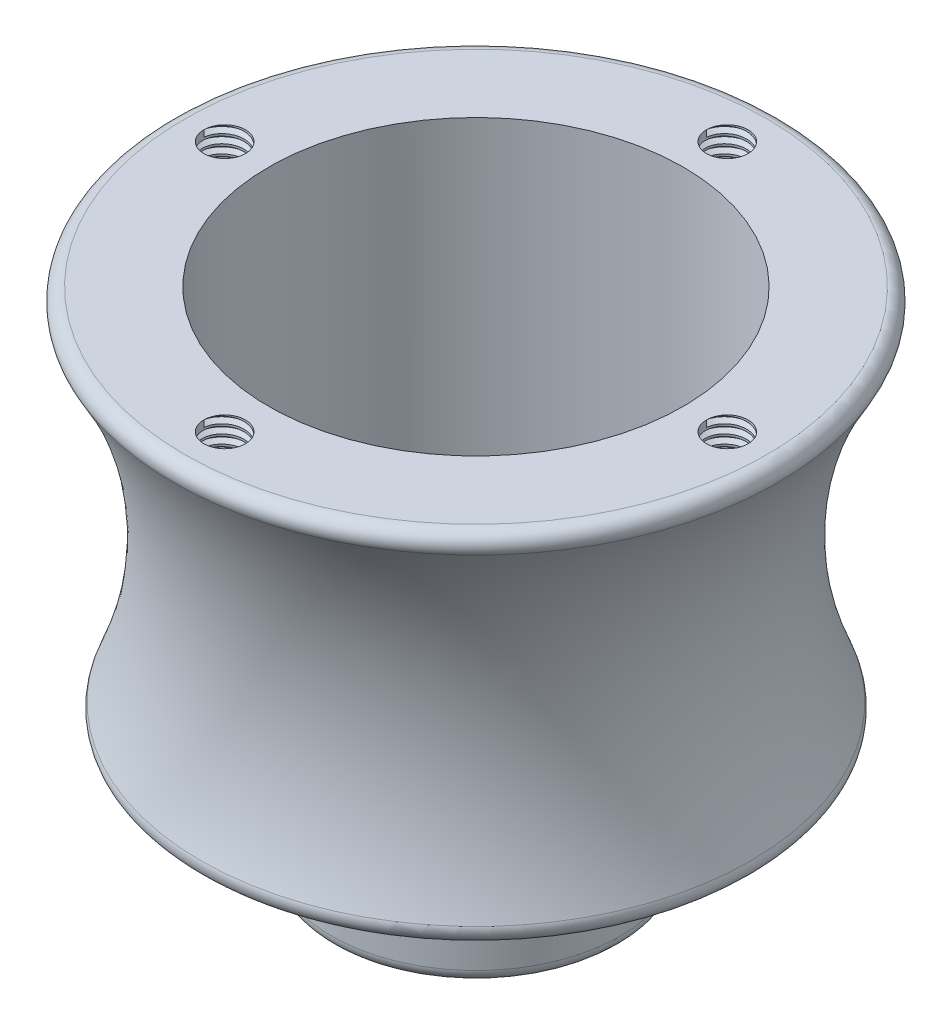
from build123d import *

# Parameters (mm, degrees)
REDONDEO4_R    = 1
REDONDEO3_R    = 1
REDONDEO5_R    = 1
MATRIZC1_COUNT = 4
ROSCA1_PITCH   = 0.7
ROSCA2_PITCH   = 0.7
ROSCA3_PITCH   = 0.7
ROSCA4_PITCH   = 0.7


with BuildPart() as part:
    # Croquis1 → Revolución1 (revolve)
    with BuildSketch(Plane.XY, mode=Mode.PRIVATE) as revoluci_n1_sk:
        with BuildLine():
            Line((25, 40), (16.5, 40))
            Line((16.5, 40), (16.5, 15))
            Line((16.5, 15), (6.35, 15))
            Line((6.35, 15), (6.35, 0))
            Line((6.35, 0), (11.5, 0))
            Line((11.5, 0), (11.5, 10))
            Line((11.5, 10), (22.5, 10))
            ThreePointArc((22.5, 10), (19.714661715, 25.33627819), (25, 40))
        make_face()
    revolve(revoluci_n1_sk.sketch.rotate(Axis((0, 0, 0), (0, 1, 0)), 90), axis=Axis((0, 0, 0), (0, 1, 0)))

    # Redondeo4
    redondeo4_edges = [part.edges().sort_by_distance(p)[0] for p in [
        (0, 10, 11.5),
    ]]
    fillet(redondeo4_edges, radius=REDONDEO4_R)

    # Redondeo3
    redondeo3_edges = [part.edges().sort_by_distance(p)[0] for p in [
        (0, 15, 16.5),
        (0, 0, 11.5),
        (0, 0, 6.35),
        (0, 15, 6.35),
    ]]
    fillet(redondeo3_edges, radius=REDONDEO3_R)

    # Redondeo5
    redondeo5_edges = [part.edges().sort_by_distance(p)[0] for p in [
        (0, 40, 25),
        (0, 10, 22.5),
    ]]
    fillet(redondeo5_edges, radius=REDONDEO5_R)

    # Croquis5 → Perforador para roscar Helicoil de M41 (revolve, cut)
    with BuildSketch(Plane(origin=(0, 40, -20), x_dir=(0, 0, 1), z_dir=(1, 0, 0))):
        Polygon((0, 0), (0, 5.991420021), (1.65, 5), (1.65, 0), align=None)
    perforador_para_roscar_helicoil_de_m41 = revolve(axis=Axis((0, 46.35, -20), (0, -1, 0)), mode=Mode.SUBTRACT)

    # MatrizC1: Perforador para roscar Helicoil de M41 ×4 about axis
    matrizc1_axis = Axis((0, 0, 0), (0, 1, 0))
    for i in range(1, MATRIZC1_COUNT):
        add(perforador_para_roscar_helicoil_de_m41.rotate(matrizc1_axis, i * 360 / MATRIZC1_COUNT), mode=Mode.SUBTRACT)

    # Rosca1: the profile of Perfil de rosca1 profile screwed along a right-hand helix of 7.142857 turns, 6 arcs to a turn; built about Z, then put on its axis
    rosca1_z = Axis((0, 0, 0), (0, 0, 1))
    rosca1_corners = [(1.6497, 0, -0.000173205), (2.028886112, 0, 0.218749999), (2.028886112, 0, 0.306249999), (1.6497, 0, 0.525173203)]
    with BuildLine(mode=Mode.PRIVATE) as rosca1_profile:
        Line(rosca1_corners[0], rosca1_corners[1])
        Line(rosca1_corners[1], rosca1_corners[2])
        Line(rosca1_corners[2], rosca1_corners[3])
        Line(rosca1_corners[3], rosca1_corners[0])
    rosca1_cap = Face(rosca1_profile.wire())
    rosca1_turn_angles = [0, 30, 60, 90, 120, 150, 180, 210, 240, 270, 300, 330, 360]
    rosca1_turn_weights = [1, 0.8660254037844387, 1, 0.8660254037844387, 1, 0.8660254037844387, 1, 0.8660254037844387, 1, 0.8660254037844387, 1, 0.8660254037844387, 1]
    rosca1_turn_rails = [Edge.make_bspline([Vector(p[0], p[1], 0).rotate(rosca1_z, rosca1_turn_angles[k]) / rosca1_turn_weights[k] + Vector(0, 0, p[2] + ROSCA1_PITCH * rosca1_turn_angles[k] / 360) for k in range(13)], [0, 0, 0, 1, 1, 2, 2, 3, 3, 4, 4, 5, 5, 6, 6, 6], 2, rosca1_turn_weights) for p in rosca1_corners]
    rosca1_turn_sides = [Face.make_surface_from_curves(rosca1_turn_rails[p[0]], rosca1_turn_rails[p[1]]) for p in [(0, 1), (1, 2), (2, 3), (3, 0)]]
    rosca1_last_angles = [2520, 2545.714285714, 2571.428571429]
    rosca1_last_weights = [1, 0.9009688679024186, 1]
    rosca1_last_rails = [Edge.make_bspline([Vector(p[0], p[1], 0).rotate(rosca1_z, rosca1_last_angles[k]) / rosca1_last_weights[k] + Vector(0, 0, p[2] + ROSCA1_PITCH * rosca1_last_angles[k] / 360) for k in range(3)], [0, 0, 0, 1, 1, 1], 2, rosca1_last_weights) for p in rosca1_corners]
    rosca1_last_sides = [Face.make_surface_from_curves(rosca1_last_rails[p[0]], rosca1_last_rails[p[1]]) for p in [(0, 1), (1, 2), (2, 3), (3, 0)]]
    rosca1 = Plane(origin=(0, 40, -20), x_dir=(-1, 0, 0), z_dir=(0, -1, 0)) * Solid(Shell([*[p.moved(Location((0, 0, ROSCA1_PITCH * i))) for i in range(7) for p in rosca1_turn_sides], *rosca1_last_sides, rosca1_cap, rosca1_cap.rotate(rosca1_z, 2571.428571429).moved(Location((0, 0, ROSCA1_PITCH * 2571.428571429 / 360)))]))
    add(rosca1, mode=Mode.SUBTRACT)

    # Rosca2: the profile of Perfil de rosca2 profile screwed along a right-hand helix of 7.142857 turns, 6 arcs to a turn; built about Z, then put on its axis
    rosca2_z = Axis((0, 0, 0), (0, 0, 1))
    rosca2_corners = [(1.6497, 0, -0.000173205), (2.028886112, 0, 0.218749999), (2.028886112, 0, 0.306249999), (1.6497, 0, 0.525173203)]
    with BuildLine(mode=Mode.PRIVATE) as rosca2_profile:
        Line(rosca2_corners[0], rosca2_corners[1])
        Line(rosca2_corners[1], rosca2_corners[2])
        Line(rosca2_corners[2], rosca2_corners[3])
        Line(rosca2_corners[3], rosca2_corners[0])
    rosca2_cap = Face(rosca2_profile.wire())
    rosca2_turn_angles = [0, 30, 60, 90, 120, 150, 180, 210, 240, 270, 300, 330, 360]
    rosca2_turn_weights = [1, 0.8660254037844387, 1, 0.8660254037844387, 1, 0.8660254037844387, 1, 0.8660254037844387, 1, 0.8660254037844387, 1, 0.8660254037844387, 1]
    rosca2_turn_rails = [Edge.make_bspline([Vector(p[0], p[1], 0).rotate(rosca2_z, rosca2_turn_angles[k]) / rosca2_turn_weights[k] + Vector(0, 0, p[2] + ROSCA2_PITCH * rosca2_turn_angles[k] / 360) for k in range(13)], [0, 0, 0, 1, 1, 2, 2, 3, 3, 4, 4, 5, 5, 6, 6, 6], 2, rosca2_turn_weights) for p in rosca2_corners]
    rosca2_turn_sides = [Face.make_surface_from_curves(rosca2_turn_rails[p[0]], rosca2_turn_rails[p[1]]) for p in [(0, 1), (1, 2), (2, 3), (3, 0)]]
    rosca2_last_angles = [2520, 2545.714285714, 2571.428571429]
    rosca2_last_weights = [1, 0.9009688679024186, 1]
    rosca2_last_rails = [Edge.make_bspline([Vector(p[0], p[1], 0).rotate(rosca2_z, rosca2_last_angles[k]) / rosca2_last_weights[k] + Vector(0, 0, p[2] + ROSCA2_PITCH * rosca2_last_angles[k] / 360) for k in range(3)], [0, 0, 0, 1, 1, 1], 2, rosca2_last_weights) for p in rosca2_corners]
    rosca2_last_sides = [Face.make_surface_from_curves(rosca2_last_rails[p[0]], rosca2_last_rails[p[1]]) for p in [(0, 1), (1, 2), (2, 3), (3, 0)]]
    rosca2 = Plane(origin=(20, 40, 0), x_dir=(-1, 0, 0), z_dir=(0, -1, 0)) * Solid(Shell([*[p.moved(Location((0, 0, ROSCA2_PITCH * i))) for i in range(7) for p in rosca2_turn_sides], *rosca2_last_sides, rosca2_cap, rosca2_cap.rotate(rosca2_z, 2571.428571429).moved(Location((0, 0, ROSCA2_PITCH * 2571.428571429 / 360)))]))
    add(rosca2, mode=Mode.SUBTRACT)

    # Rosca3: the profile of Perfil de rosca3 profile screwed along a right-hand helix of 7.142857 turns, 6 arcs to a turn; built about Z, then put on its axis
    rosca3_z = Axis((0, 0, 0), (0, 0, 1))
    rosca3_corners = [(1.6497, 0, -0.000173205), (2.028886112, 0, 0.218749999), (2.028886112, 0, 0.306249999), (1.6497, 0, 0.525173203)]
    with BuildLine(mode=Mode.PRIVATE) as rosca3_profile:
        Line(rosca3_corners[0], rosca3_corners[1])
        Line(rosca3_corners[1], rosca3_corners[2])
        Line(rosca3_corners[2], rosca3_corners[3])
        Line(rosca3_corners[3], rosca3_corners[0])
    rosca3_cap = Face(rosca3_profile.wire())
    rosca3_turn_angles = [0, 30, 60, 90, 120, 150, 180, 210, 240, 270, 300, 330, 360]
    rosca3_turn_weights = [1, 0.8660254037844387, 1, 0.8660254037844387, 1, 0.8660254037844387, 1, 0.8660254037844387, 1, 0.8660254037844387, 1, 0.8660254037844387, 1]
    rosca3_turn_rails = [Edge.make_bspline([Vector(p[0], p[1], 0).rotate(rosca3_z, rosca3_turn_angles[k]) / rosca3_turn_weights[k] + Vector(0, 0, p[2] + ROSCA3_PITCH * rosca3_turn_angles[k] / 360) for k in range(13)], [0, 0, 0, 1, 1, 2, 2, 3, 3, 4, 4, 5, 5, 6, 6, 6], 2, rosca3_turn_weights) for p in rosca3_corners]
    rosca3_turn_sides = [Face.make_surface_from_curves(rosca3_turn_rails[p[0]], rosca3_turn_rails[p[1]]) for p in [(0, 1), (1, 2), (2, 3), (3, 0)]]
    rosca3_last_angles = [2520, 2545.714285714, 2571.428571429]
    rosca3_last_weights = [1, 0.9009688679024186, 1]
    rosca3_last_rails = [Edge.make_bspline([Vector(p[0], p[1], 0).rotate(rosca3_z, rosca3_last_angles[k]) / rosca3_last_weights[k] + Vector(0, 0, p[2] + ROSCA3_PITCH * rosca3_last_angles[k] / 360) for k in range(3)], [0, 0, 0, 1, 1, 1], 2, rosca3_last_weights) for p in rosca3_corners]
    rosca3_last_sides = [Face.make_surface_from_curves(rosca3_last_rails[p[0]], rosca3_last_rails[p[1]]) for p in [(0, 1), (1, 2), (2, 3), (3, 0)]]
    rosca3 = Plane(origin=(0, 40, 20), x_dir=(-1, 0, 0), z_dir=(0, -1, 0)) * Solid(Shell([*[p.moved(Location((0, 0, ROSCA3_PITCH * i))) for i in range(7) for p in rosca3_turn_sides], *rosca3_last_sides, rosca3_cap, rosca3_cap.rotate(rosca3_z, 2571.428571429).moved(Location((0, 0, ROSCA3_PITCH * 2571.428571429 / 360)))]))
    add(rosca3, mode=Mode.SUBTRACT)

    # Rosca4: the profile of Perfil de rosca4 profile screwed along a right-hand helix of 7.142857 turns, 6 arcs to a turn; built about Z, then put on its axis
    rosca4_z = Axis((0, 0, 0), (0, 0, 1))
    rosca4_corners = [(1.6497, 0, -0.000173205), (2.028886112, 0, 0.218749999), (2.028886112, 0, 0.306249999), (1.6497, 0, 0.525173203)]
    with BuildLine(mode=Mode.PRIVATE) as rosca4_profile:
        Line(rosca4_corners[0], rosca4_corners[1])
        Line(rosca4_corners[1], rosca4_corners[2])
        Line(rosca4_corners[2], rosca4_corners[3])
        Line(rosca4_corners[3], rosca4_corners[0])
    rosca4_cap = Face(rosca4_profile.wire())
    rosca4_turn_angles = [0, 30, 60, 90, 120, 150, 180, 210, 240, 270, 300, 330, 360]
    rosca4_turn_weights = [1, 0.8660254037844387, 1, 0.8660254037844387, 1, 0.8660254037844387, 1, 0.8660254037844387, 1, 0.8660254037844387, 1, 0.8660254037844387, 1]
    rosca4_turn_rails = [Edge.make_bspline([Vector(p[0], p[1], 0).rotate(rosca4_z, rosca4_turn_angles[k]) / rosca4_turn_weights[k] + Vector(0, 0, p[2] + ROSCA4_PITCH * rosca4_turn_angles[k] / 360) for k in range(13)], [0, 0, 0, 1, 1, 2, 2, 3, 3, 4, 4, 5, 5, 6, 6, 6], 2, rosca4_turn_weights) for p in rosca4_corners]
    rosca4_turn_sides = [Face.make_surface_from_curves(rosca4_turn_rails[p[0]], rosca4_turn_rails[p[1]]) for p in [(0, 1), (1, 2), (2, 3), (3, 0)]]
    rosca4_last_angles = [2520, 2545.714285714, 2571.428571429]
    rosca4_last_weights = [1, 0.9009688679024186, 1]
    rosca4_last_rails = [Edge.make_bspline([Vector(p[0], p[1], 0).rotate(rosca4_z, rosca4_last_angles[k]) / rosca4_last_weights[k] + Vector(0, 0, p[2] + ROSCA4_PITCH * rosca4_last_angles[k] / 360) for k in range(3)], [0, 0, 0, 1, 1, 1], 2, rosca4_last_weights) for p in rosca4_corners]
    rosca4_last_sides = [Face.make_surface_from_curves(rosca4_last_rails[p[0]], rosca4_last_rails[p[1]]) for p in [(0, 1), (1, 2), (2, 3), (3, 0)]]
    rosca4 = Plane(origin=(-20, 40, 0), x_dir=(-1, 0, 0), z_dir=(0, -1, 0)) * Solid(Shell([*[p.moved(Location((0, 0, ROSCA4_PITCH * i))) for i in range(7) for p in rosca4_turn_sides], *rosca4_last_sides, rosca4_cap, rosca4_cap.rotate(rosca4_z, 2571.428571429).moved(Location((0, 0, ROSCA4_PITCH * 2571.428571429 / 360)))]))
    add(rosca4, mode=Mode.SUBTRACT)


solid = part.part
